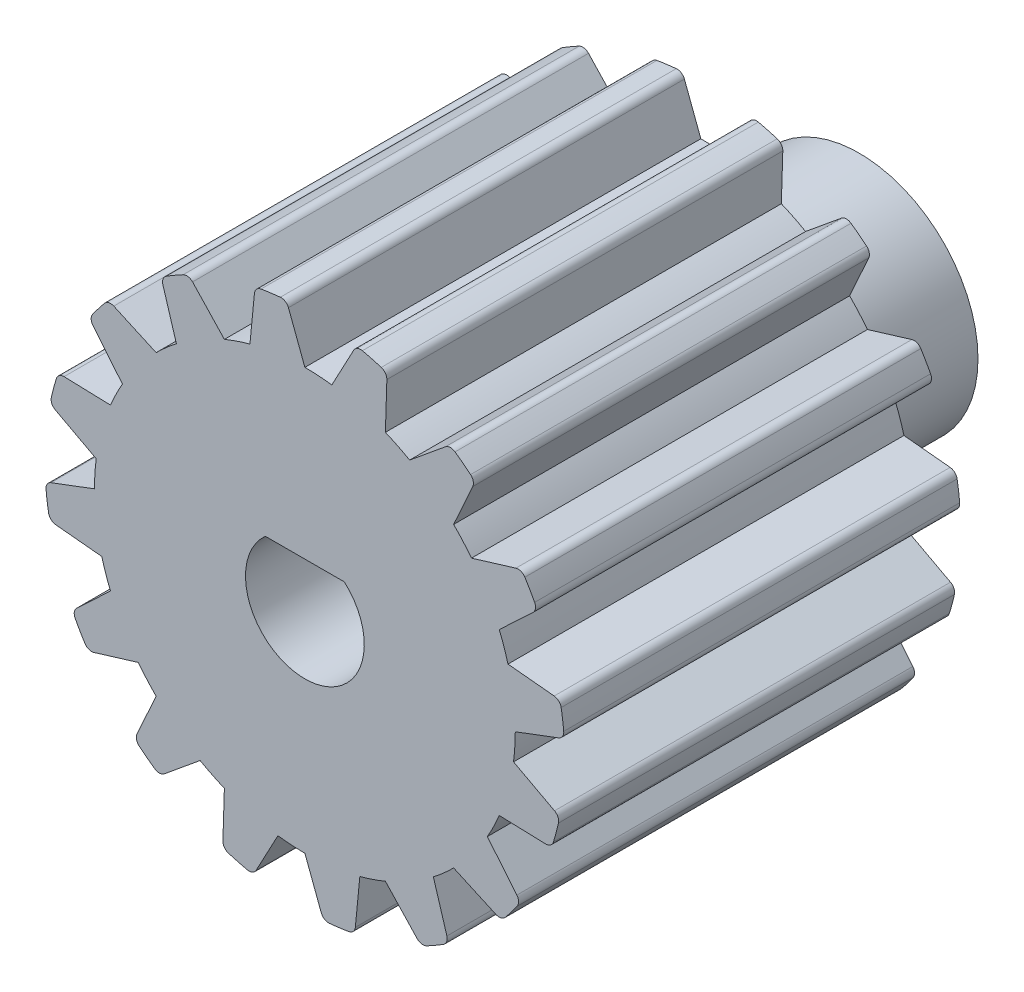
from build123d import *

# Parameters (mm, degrees)
SALIENTE_EXTRUIR1_DEPTH = 15
CROQUIS5_R              = 4.5
SALIENTE_EXTRUIR2_DEPTH = 6
CORTAR_EXTRUIR1_DEPTH   = 26.166810333


with BuildPart() as part:
    # Croquis2 → Saliente-Extruir1 (new body)
    with BuildSketch(Plane.XY):
        with BuildLine():
            Line((-2.081696937, 7.693567449), (-1.911179214, 9.445287663))
            ThreePointArc((-1.911179214, 9.445287663), (-1.831468139, 9.618345927), (-1.663611198, 9.708496165))
            ThreePointArc((-1.663611198, 9.708496165), (-1.297642615, 9.764149919), (-0.929841298, 9.806013214))
            ThreePointArc((-0.929841298, 9.806013214), (-0.744265019, 9.762833784), (-0.622120698, 9.616601835))
            Line((-0.622120698, 9.616601835), (0, 7.97022222))
            ThreePointArc((0, 7.97022222), (0.511536449, 7.953789832), (1.020963606, 7.904560428))
            Line((1.020963606, 7.904560428), (1.848855744, 9.457684572))
            ThreePointArc((1.848855744, 9.457684572), (1.988725705, 9.587065453), (2.1783043, 9.606117341))
            ThreePointArc((2.1783043, 9.606117341), (2.537712953, 9.517484592), (2.893537451, 9.415409764))
            ThreePointArc((2.893537451, 9.415409764), (3.048463524, 9.304500205), (3.105349619, 9.122656892))
            Line((3.105349619, 9.122656892), (3.050071996, 7.363525179))
            ThreePointArc((3.050071996, 7.363525179), (3.516381649, 7.152587108), (3.968191694, 6.912155736))
            Line((3.968191694, 6.912155736), (5.327419174, 8.030234739))
            ThreePointArc((5.327419174, 8.030234739), (5.506154088, 8.09624117), (5.688592714, 8.041294232))
            ThreePointArc((5.688592714, 8.041294232), (5.986724728, 7.821868513), (6.276401353, 7.591395527))
            ThreePointArc((6.276401353, 7.591395527), (6.37709113, 7.429640815), (6.360058606, 7.239870134))
            Line((6.360058606, 7.239870134), (5.635798179, 5.635798179))
            ThreePointArc((5.635798179, 5.635798179), (5.985889619, 5.262467835), (6.311298569, 4.867437992))
            Line((6.311298569, 4.867437992), (7.994931329, 5.380254461))
            ThreePointArc((7.994931329, 5.380254461), (8.185320425, 5.372837562), (8.332844455, 5.252256971))
            ThreePointArc((8.332844455, 5.252256971), (8.524311933, 4.935443857), (8.703740045, 4.611660138))
            ThreePointArc((8.703740045, 4.611660138), (8.73486442, 4.42368596), (8.646506324, 4.254878777))
            Line((8.646506324, 4.254878777), (7.363525179, 3.050071996))
            ThreePointArc((7.363525179, 3.050071996), (7.544100156, 2.571185538), (7.693567449, 2.081696937))
            Line((7.693567449, 2.081696937), (9.445287663, 1.911179214))
            ThreePointArc((9.445287663, 1.911179214), (9.618345927, 1.831468139), (9.708496165, 1.663611198))
            ThreePointArc((9.708496165, 1.663611198), (9.764149919, 1.297642615), (9.806013214, 0.929841298))
            ThreePointArc((9.806013214, 0.929841298), (9.762833784, 0.744265019), (9.616601835, 0.622120698))
            Line((9.616601835, 0.622120698), (7.97022222, 0))
            ThreePointArc((7.97022222, 0), (7.953789832, -0.511536449), (7.904560428, -1.020963606))
            Line((7.904560428, -1.020963606), (9.457684572, -1.848855744))
            ThreePointArc((9.457684572, -1.848855744), (9.587065453, -1.988725705), (9.606117341, -2.1783043))
            ThreePointArc((9.606117341, -2.1783043), (9.517484592, -2.537712953), (9.415409764, -2.893537451))
            ThreePointArc((9.415409764, -2.893537451), (9.304500205, -3.048463524), (9.122656892, -3.105349619))
            Line((9.122656892, -3.105349619), (7.363525179, -3.050071996))
            ThreePointArc((7.363525179, -3.050071996), (7.152587108, -3.516381649), (6.912155736, -3.968191694))
            Line((6.912155736, -3.968191694), (8.030234739, -5.327419174))
            ThreePointArc((8.030234739, -5.327419174), (8.09624117, -5.506154088), (8.041294232, -5.688592714))
            ThreePointArc((8.041294232, -5.688592714), (7.821868513, -5.986724728), (7.591395527, -6.276401353))
            ThreePointArc((7.591395527, -6.276401353), (7.429640815, -6.37709113), (7.239870134, -6.360058606))
            Line((7.239870134, -6.360058606), (5.635798179, -5.635798179))
            ThreePointArc((5.635798179, -5.635798179), (5.262467835, -5.985889619), (4.867437992, -6.311298569))
            Line((4.867437992, -6.311298569), (5.380254461, -7.994931329))
            ThreePointArc((5.380254461, -7.994931329), (5.372837562, -8.185320425), (5.252256971, -8.332844455))
            ThreePointArc((5.252256971, -8.332844455), (4.935443857, -8.524311933), (4.611660138, -8.703740045))
            ThreePointArc((4.611660138, -8.703740045), (4.42368596, -8.73486442), (4.254878777, -8.646506324))
            Line((4.254878777, -8.646506324), (3.050071996, -7.363525179))
            ThreePointArc((3.050071996, -7.363525179), (2.571185538, -7.544100156), (2.081696937, -7.693567449))
            Line((2.081696937, -7.693567449), (1.911179214, -9.445287663))
            ThreePointArc((1.911179214, -9.445287663), (1.831468139, -9.618345927), (1.663611198, -9.708496165))
            ThreePointArc((1.663611198, -9.708496165), (1.297642615, -9.764149919), (0.929841298, -9.806013214))
            ThreePointArc((0.929841298, -9.806013214), (0.744265019, -9.762833784), (0.622120698, -9.616601835))
            Line((0.622120698, -9.616601835), (0, -7.97022222))
            ThreePointArc((0, -7.97022222), (-0.511536449, -7.953789832), (-1.020963606, -7.904560428))
            Line((-1.020963606, -7.904560428), (-1.848855744, -9.457684572))
            ThreePointArc((-1.848855744, -9.457684572), (-1.988725705, -9.587065453), (-2.1783043, -9.606117341))
            ThreePointArc((-2.1783043, -9.606117341), (-2.537712953, -9.517484592), (-2.893537451, -9.415409764))
            ThreePointArc((-2.893537451, -9.415409764), (-3.048463524, -9.304500205), (-3.105349619, -9.122656892))
            Line((-3.105349619, -9.122656892), (-3.050071996, -7.363525179))
            ThreePointArc((-3.050071996, -7.363525179), (-3.516381649, -7.152587108), (-3.968191694, -6.912155736))
            Line((-3.968191694, -6.912155736), (-5.327419174, -8.030234739))
            ThreePointArc((-5.327419174, -8.030234739), (-5.506154088, -8.09624117), (-5.688592714, -8.041294232))
            ThreePointArc((-5.688592714, -8.041294232), (-5.986724728, -7.821868513), (-6.276401353, -7.591395527))
            ThreePointArc((-6.276401353, -7.591395527), (-6.37709113, -7.429640815), (-6.360058606, -7.239870134))
            Line((-6.360058606, -7.239870134), (-5.635798179, -5.635798179))
            ThreePointArc((-5.635798179, -5.635798179), (-5.985889619, -5.262467835), (-6.311298569, -4.867437992))
            Line((-6.311298569, -4.867437992), (-7.994931329, -5.380254461))
            ThreePointArc((-7.994931329, -5.380254461), (-8.185320425, -5.372837562), (-8.332844455, -5.252256971))
            ThreePointArc((-8.332844455, -5.252256971), (-8.524311933, -4.935443857), (-8.703740045, -4.611660138))
            ThreePointArc((-8.703740045, -4.611660138), (-8.73486442, -4.42368596), (-8.646506324, -4.254878777))
            Line((-8.646506324, -4.254878777), (-7.363525179, -3.050071996))
            ThreePointArc((-7.363525179, -3.050071996), (-7.544100156, -2.571185538), (-7.693567449, -2.081696937))
            Line((-7.693567449, -2.081696937), (-9.445287663, -1.911179214))
            ThreePointArc((-9.445287663, -1.911179214), (-9.618345927, -1.831468139), (-9.708496165, -1.663611198))
            ThreePointArc((-9.708496165, -1.663611198), (-9.764149919, -1.297642615), (-9.806013214, -0.929841298))
            ThreePointArc((-9.806013214, -0.929841298), (-9.762833784, -0.744265019), (-9.616601835, -0.622120698))
            Line((-9.616601835, -0.622120698), (-7.97022222, 0))
            ThreePointArc((-7.97022222, 0), (-7.953789832, 0.511536449), (-7.904560428, 1.020963606))
            Line((-7.904560428, 1.020963606), (-9.457684572, 1.848855744))
            ThreePointArc((-9.457684572, 1.848855744), (-9.587065453, 1.988725705), (-9.606117341, 2.1783043))
            ThreePointArc((-9.606117341, 2.1783043), (-9.517484592, 2.537712953), (-9.415409764, 2.893537451))
            ThreePointArc((-9.415409764, 2.893537451), (-9.304500205, 3.048463524), (-9.122656892, 3.105349619))
            Line((-9.122656892, 3.105349619), (-7.363525179, 3.050071996))
            ThreePointArc((-7.363525179, 3.050071996), (-7.152587108, 3.516381649), (-6.912155736, 3.968191694))
            Line((-6.912155736, 3.968191694), (-8.030234739, 5.327419174))
            ThreePointArc((-8.030234739, 5.327419174), (-8.09624117, 5.506154088), (-8.041294232, 5.688592714))
            ThreePointArc((-8.041294232, 5.688592714), (-7.821868513, 5.986724728), (-7.591395527, 6.276401353))
            ThreePointArc((-7.591395527, 6.276401353), (-7.429640815, 6.37709113), (-7.239870134, 6.360058606))
            Line((-7.239870134, 6.360058606), (-5.635798179, 5.635798179))
            ThreePointArc((-5.635798179, 5.635798179), (-5.262467835, 5.985889619), (-4.867437992, 6.311298569))
            Line((-4.867437992, 6.311298569), (-5.380254461, 7.994931329))
            ThreePointArc((-5.380254461, 7.994931329), (-5.372837562, 8.185320425), (-5.252256971, 8.332844455))
            ThreePointArc((-5.252256971, 8.332844455), (-4.935443857, 8.524311933), (-4.611660138, 8.703740045))
            ThreePointArc((-4.611660138, 8.703740045), (-4.42368596, 8.73486442), (-4.254878777, 8.646506324))
            Line((-4.254878777, 8.646506324), (-3.050071996, 7.363525179))
            ThreePointArc((-3.050071996, 7.363525179), (-2.571185538, 7.544100156), (-2.081696937, 7.693567449))
        make_face()
    extrude(amount=SALIENTE_EXTRUIR1_DEPTH)

    # Croquis5 → Saliente-Extruir2 (add)
    with BuildSketch(Plane(origin=(0, 0, 0), x_dir=(-1, 0, 0), z_dir=(0, 0, -1))):
        Circle(CROQUIS5_R)
    extrude(amount=SALIENTE_EXTRUIR2_DEPTH)

    # Croquis3 → Cortar-Extruir1 (cut, through all)
    with BuildSketch(Plane.XY.offset(15)):
        with BuildLine():
            Line((-1.496696362, 1.68), (1.496696362, 1.68))
            ThreePointArc((1.496696362, 1.68), (0, -2.25), (-1.496696362, 1.68))
        make_face()
    extrude(amount=-CORTAR_EXTRUIR1_DEPTH, mode=Mode.SUBTRACT)


solid = part.part
